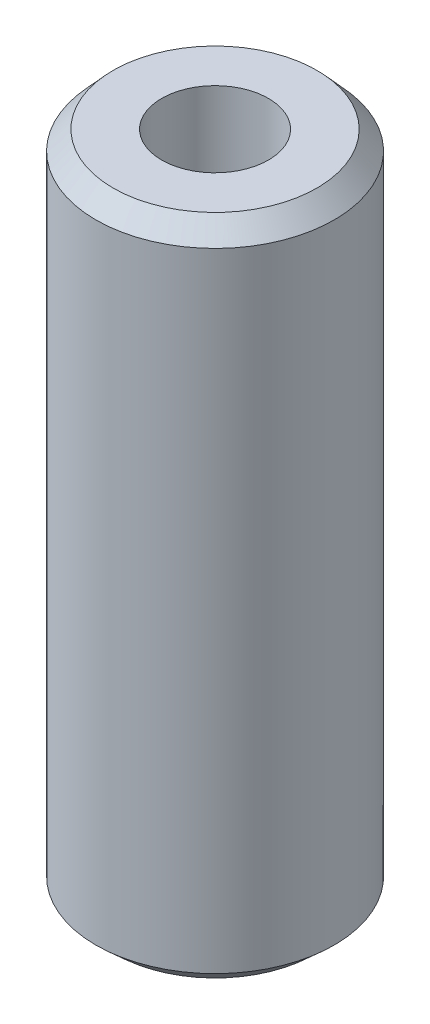
from build123d import *
from OCP.BRepFilletAPI import BRepFilletAPI_MakeChamfer

# Parameters (mm, degrees)
SKETCH1_R           = 10
BOSS_EXTRUDE1_DEPTH = 55.750900221
SKETCH2_R           = 4.483063065
CUT_EXTRUDE1_DEPTH  = 58.516631295
CHAMFER1_SIZE       = 1.594245223
CHAMFER1_SIZE2      = 1.444758598


with BuildPart() as part:
    # Sketch1 → Boss-Extrude1 (new body)
    with BuildSketch(Plane(origin=(0, 0, 0), x_dir=(1, 0, 0), z_dir=(0, 1, 0))):
        Circle(SKETCH1_R)
    extrude(amount=BOSS_EXTRUDE1_DEPTH)

    # Sketch2 → Cut-Extrude1 (cut, through all)
    with BuildSketch(Plane(origin=(0, 0, 0), x_dir=(1, 0, 0), z_dir=(0, 1, 0))):
        Circle(SKETCH2_R)
    extrude(amount=CUT_EXTRUDE1_DEPTH, mode=Mode.SUBTRACT)

    # Chamfer1: one chamfer whose edges measure the first distance from different faces: ONE call of the kernel's chamfer builder (chamfer() names one face for all edges)
    chamfer1_edges_1 = [part.edges().sort_by_distance(p)[0] for p in [
        (-10, 55.750900221, 0),
    ]]
    chamfer1_side_1 = [part.faces().sort_by_distance(p)[0] for p in [
        (-10, 27.875450111, 0),
    ]]
    chamfer1_edges_2 = [part.edges().sort_by_distance(p)[0] for p in [
        (-10, 0, 0),
    ]]
    chamfer1_side_2 = [part.faces().sort_by_distance(p)[0] for p in [
        (-9.717157288, 0, 0),
    ]]
    chamfer1 = BRepFilletAPI_MakeChamfer(part.part.solid().wrapped)
    for e in chamfer1_edges_1:
        chamfer1.Add(CHAMFER1_SIZE, CHAMFER1_SIZE2, e.wrapped, chamfer1_side_1[0].wrapped)  # the first distance lies on this face
    for e in chamfer1_edges_2:
        chamfer1.Add(CHAMFER1_SIZE, CHAMFER1_SIZE2, e.wrapped, chamfer1_side_2[0].wrapped)  # the first distance lies on this face
    add(Compound.cast(chamfer1.Shape()), mode=Mode.REPLACE)


solid = part.part
